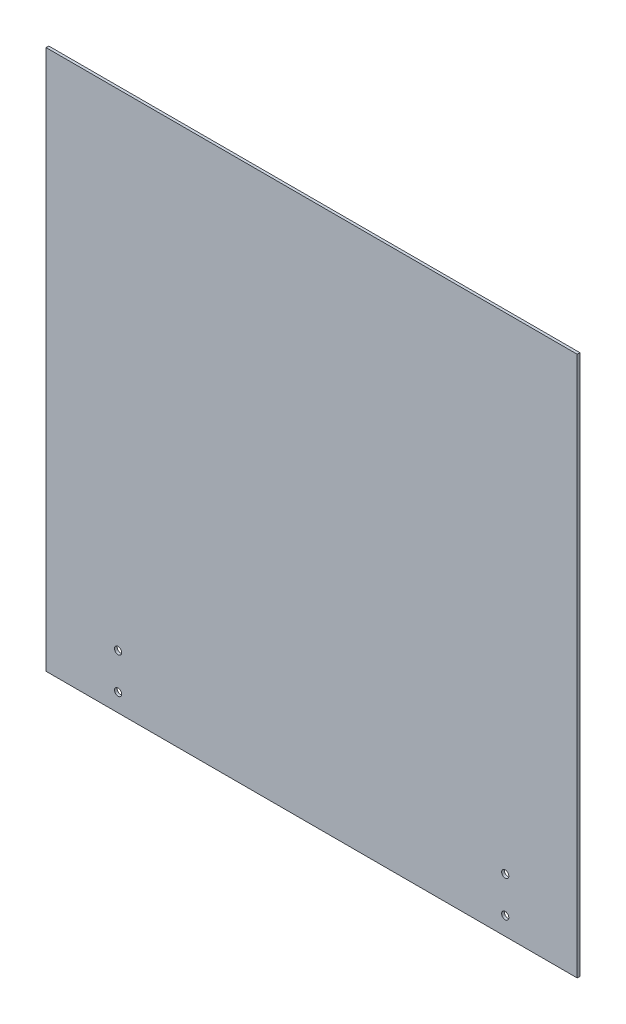
from build123d import *

# Parameters (mm, degrees)
SKETCH_1_W             = 295
SKETCH_1_H             = 300
SKETCH_1_R             = 2
SM_BASE_FLANGE_1_DEPTH = 1.5


# Sheet-metal steps are written as plain solids
with BuildPart() as part:
    # Sketch 1 → 基体-法兰1 (new body)
    with BuildSketch(Plane.XY):
        Rectangle(SKETCH_1_W, SKETCH_1_H)
        with Locations((107.5, -140)):
            Circle(SKETCH_1_R, mode=Mode.SUBTRACT)
        with Locations((107.5, -120)):
            Circle(SKETCH_1_R, mode=Mode.SUBTRACT)
        with Locations((-107.5, -120)):
            Circle(SKETCH_1_R, mode=Mode.SUBTRACT)
        with Locations((-107.5, -140)):
            Circle(SKETCH_1_R, mode=Mode.SUBTRACT)
    extrude(amount=-SM_BASE_FLANGE_1_DEPTH)


solid = part.part
